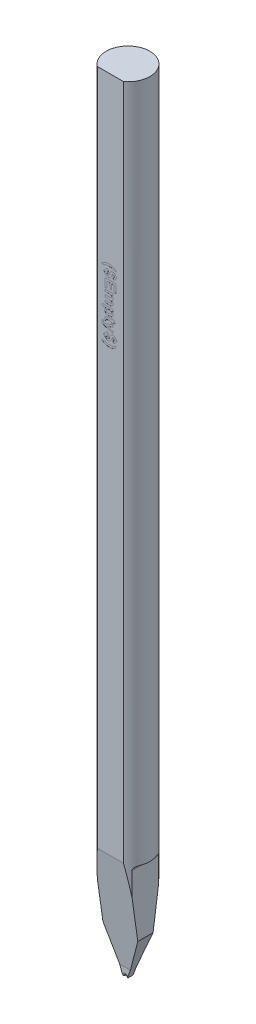
from build123d import *

# Parameters (mm, degrees)
SKETCH_TL_CUTTING_R       = 1.99771
TL_CUTTING_DEPTH          = 72.009
SKETCH_TDF_GRINDING_W     = 4.01542
SKETCH_TDF_GRINDING_H     = 4.01542
TDF_GRINDING_DEPTH        = 73.064400167
ENGRAVING_DEPTH           = 0.005
VW_VR_GRINDING_DEPTH      = 2.00771
VW_VR_GRINDING_DEPTH_BACK = 2.00771
ISA_GRINDING_DEPTH        = 2.00771
ISA_GRINDING_DEPTH_BACK   = 2.00771
PRE_FRX_BRX_DEPTH         = 2.00771
PRE_FRX_BRX_DEPTH_BACK    = 2.00771
SKETCH_PRE_FRX_BRX_W      = 1.7372
SKETCH_PRE_FRX_BRX_H      = 0.78994
FR_EDM_R                  = 0.20066
BR_EDM_R                  = 0.09906
FA_BA_GRINDING_DEPTH      = 2.00771
FA_BA_GRINDING_DEPTH_BACK = 2.00771


with BuildPart() as part:
    # sketch_TL_cutting → TL_cutting (new body)
    with BuildSketch(Plane(origin=(0, 0, 0), x_dir=(1, 0, 0), z_dir=(0, 1, 0))):
        Circle(SKETCH_TL_CUTTING_R)
    extrude(amount=TL_CUTTING_DEPTH)

    # sketch_TDF_grinding → TDF_grinding (cut, through all)
    with BuildSketch(Plane(origin=(0, 0, 0), x_dir=(1, 0, 0), z_dir=(0, 1, 0))):
        with Locations((0, -3.60918)):
            Rectangle(SKETCH_TDF_GRINDING_W, SKETCH_TDF_GRINDING_H)
    extrude(amount=TDF_GRINDING_DEPTH, mode=Mode.SUBTRACT)

    # sketch_engraving → engraving (cut)
    # profile 1 of 9: a face of its own
    with BuildSketch(Plane.XY.offset(1.60147)):
        with BuildLine():
            Line((-0.769230769, 56.611564103), (-0.769230769, 56.726948718))
            add(Edge.make_bspline(
                [(-0.769230769, 56.726948718), (-0.75654381, 56.735663826), (-0.731271202, 56.75302445), (-0.692407522, 56.777108744), (-0.653253405, 56.799807931), (-0.61390654, 56.821057444), (-0.574088198, 56.840594152), (-0.533834647, 56.85827299), (-0.493399806, 56.874882514), (-0.452559629, 56.889379278), (-0.411730957, 56.902372472), (-0.37117072, 56.913933672), (-0.330720232, 56.923167297), (-0.290776237, 56.931412038), (-0.251027852, 56.937272807), (-0.211754164, 56.941765375), (-0.172781576, 56.944468765), (-0.146905785, 56.944754889), (-0.134014423, 56.944897436)],
                knots=[0, 0, 0, 0, 1.083507766, 2.158363427, 3.217863588, 4.26952313, 5.306027247, 6.339424422, 7.364296331, 8.382863073, 9.389381803, 10.380601174, 11.351000725, 12.30983044, 13.25126181, 14.178453692, 15.092502614, 16, 16, 16, 16], degree=3))
            add(Edge.make_bspline(
                [(-0.134014423, 56.944897436), (-0.118183889, 56.944720886), (-0.086756823, 56.944370396), (-0.039956705, 56.941072127), (0.006211299, 56.935593151), (0.051774559, 56.928331702), (0.096653064, 56.918551161), (0.140935004, 56.90698945), (0.184649405, 56.893283306), (0.2131297, 56.882285182), (0.227363782, 56.876788462)],
                knots=[0, 0, 0, 0, 1.026825403, 2.038472649, 3.041589395, 4.042121555, 5.030199178, 6.019908545, 7.010375948, 8, 8, 8, 8], degree=3))
            add(Edge.make_bspline(
                [(0.227363782, 56.876788462), (0.251683724, 56.86662748), (0.300012726, 56.846435406), (0.369571494, 56.810574678), (0.43660795, 56.771337941), (0.478889333, 56.74173111), (0.5, 56.726948718)],
                knots=[0, 0, 0, 0, 1.013799707, 2.014640032, 3.00872983, 4, 4, 4, 4], degree=3))
            Line((0.5, 56.726948718), (0.5, 56.611564103))
            add(Edge.make_bspline(
                [(0.5, 56.611564103), (0.483671183, 56.618120598), (0.451734259, 56.630944202), (0.404403907, 56.648404634), (0.359131946, 56.664765299), (0.315658143, 56.679413628), (0.273946214, 56.69238068), (0.234213299, 56.70413527), (0.196217088, 56.713881677), (0.148045143, 56.725244778), (0.087918925, 56.736328711), (0.014547585, 56.745586625), (-0.060927268, 56.751701265), (-0.111967077, 56.752291015), (-0.137820513, 56.752589744)],
                knots=[0, 0, 0, 0, 0.962863393, 1.883228553, 2.76049045, 3.597092273, 4.393389301, 5.150807945, 5.864262675, 6.539665604, 7.859093728, 9.207470704, 10.585486956, 12, 12, 12, 12], degree=3))
            add(Edge.make_bspline(
                [(-0.137820513, 56.752589744), (-0.155988322, 56.752343487), (-0.192554908, 56.751847842), (-0.247746387, 56.748261408), (-0.303631191, 56.742771672), (-0.359778417, 56.734616456), (-0.415599441, 56.724983778), (-0.470281715, 56.713252997), (-0.523675907, 56.700229417), (-0.558467126, 56.689835667), (-0.575721154, 56.68468109)],
                knots=[0, 0, 0, 0, 0.980476084, 1.97341699, 2.983932057, 4.010380506, 5.034783484, 6.040583597, 7.02826557, 8, 8, 8, 8], degree=3))
            add(Edge.make_bspline(
                [(-0.575721154, 56.68468109), (-0.581680072, 56.682859776), (-0.594203733, 56.679031979), (-0.613643056, 56.671976075), (-0.635084462, 56.664505083), (-0.658352199, 56.655786341), (-0.683499135, 56.646272512), (-0.710430496, 56.635536673), (-0.739235975, 56.623981317), (-0.7590223, 56.615790194), (-0.769230769, 56.611564103)],
                knots=[0, 0, 0, 0, 0.722569934, 1.518601428, 2.397973139, 3.356076064, 4.400297102, 5.516290093, 6.718565658, 8, 8, 8, 8], degree=3))
        make_face()
    # profile 2 of 9: a face of its own
    with BuildSketch(Plane.XY.offset(1.60147)):
        with BuildLine():
            Line((-0.346153846, 56.226948718), (-0.063902244, 56.226948718))
            add(Edge.make_bspline(
                [(-0.063902244, 56.226948718), (-0.060691422, 56.237143266), (-0.054417647, 56.257062868), (-0.043102981, 56.285435864), (-0.03104034, 56.311894737), (-0.017255553, 56.335922913), (-0.002706808, 56.358195401), (0.013349437, 56.378160446), (0.030392388, 56.396185381), (0.048816212, 56.411900426), (0.068263793, 56.425644345), (0.088567069, 56.437911105), (0.110125164, 56.447723618), (0.132438861, 56.456389102), (0.155973296, 56.462652823), (0.180398952, 56.467325467), (0.205875491, 56.469883399), (0.223151848, 56.470317076), (0.231971154, 56.470538462)],
                knots=[0, 0, 0, 0, 1.233471439, 2.410137288, 3.52407584, 4.58730311, 5.604983541, 6.592165279, 7.540854934, 8.464761394, 9.382375568, 10.287963167, 11.198393515, 12.113251355, 13.048281916, 14.005296989, 14.981735836, 16, 16, 16, 16], degree=3))
            add(Edge.make_bspline(
                [(0.231971154, 56.470538462), (0.240862374, 56.470369834), (0.258371063, 56.47003777), (0.284035262, 56.466710465), (0.308630388, 56.461512705), (0.332214124, 56.454327878), (0.354666156, 56.444872426), (0.375999861, 56.433410852), (0.396225213, 56.419891645), (0.415061575, 56.404246572), (0.432812136, 56.387237259), (0.448139285, 56.36818408), (0.461933462, 56.348127842), (0.473588781, 56.326562978), (0.483166571, 56.303572929), (0.491049568, 56.279359162), (0.496663149, 56.253639945), (0.49887037, 56.235984548), (0.5, 56.226948718)],
                knots=[0, 0, 0, 0, 1.065419917, 2.098036635, 3.096580821, 4.076501369, 5.04880669, 6.012240184, 6.975806694, 7.959773282, 8.944748783, 9.917449457, 10.885494533, 11.859775015, 12.849941464, 13.867618658, 14.908671599, 16, 16, 16, 16], degree=3))
            Line((0.5, 56.226948718), (0.576923077, 56.226948718))
            Line((0.576923077, 56.226948718), (0.576923077, 56.124384615))
            Line((0.576923077, 56.124384615), (0.5, 56.124384615))
            add(Edge.make_bspline(
                [(0.5, 56.124384615), (0.498841424, 56.115486686), (0.496573389, 56.09806805), (0.49137632, 56.072741064), (0.484539762, 56.048860422), (0.476339583, 56.026349842), (0.466697028, 56.005143702), (0.455518194, 55.985361964), (0.442840864, 55.966933141), (0.428527318, 55.95018479), (0.413145824, 55.934584638), (0.39610941, 55.920827789), (0.378155721, 55.908112331), (0.358829355, 55.897061433), (0.338178987, 55.887674614), (0.316411919, 55.87941047), (0.293274546, 55.872799442), (0.27733531, 55.869600771), (0.269230769, 55.867974359)],
                knots=[0, 0, 0, 0, 1.151887312, 2.254940947, 3.31604567, 4.338626222, 5.328478017, 6.30366564, 7.252607131, 8.195603958, 9.129238937, 10.061258459, 11.003163313, 11.951756149, 12.914654824, 13.913120779, 14.938895277, 16, 16, 16, 16], degree=3))
            Line((0.269230769, 55.867974359), (0.243589744, 56.034641026))
            add(Edge.make_bspline(
                [(0.243589744, 56.034641026), (0.250446456, 56.036643558), (0.263771485, 56.040535192), (0.282535036, 56.048465441), (0.299671316, 56.057678859), (0.315110354, 56.068227628), (0.328747964, 56.080224188), (0.340615646, 56.09355588), (0.351026936, 56.108191319), (0.356312409, 56.118960751), (0.358974359, 56.124384615)],
                knots=[0, 0, 0, 0, 1.132612369, 2.201068414, 3.225051706, 4.215432487, 5.161289188, 6.099220658, 7.04270083, 8, 8, 8, 8], degree=3))
            Line((0.358974359, 56.124384615), (0.095552885, 56.124384615))
            add(Edge.make_bspline(
                [(0.095552885, 56.124384615), (0.091846888, 56.111134392), (0.084711092, 56.085621445), (0.072793936, 56.049230821), (0.059721416, 56.016296736), (0.046029912, 55.986577051), (0.031359337, 55.960199095), (0.016057305, 55.936950063), (-0.000406851, 55.917264806), (-0.017692985, 55.90057685), (-0.036309981, 55.887032312), (-0.055531671, 55.874731893), (-0.076319964, 55.864821076), (-0.098285192, 55.856514134), (-0.121510852, 55.850207549), (-0.145938277, 55.845497559), (-0.171622588, 55.842996815), (-0.189164574, 55.842557523), (-0.198116987, 55.842333333)],
                knots=[0, 0, 0, 0, 1.47567488, 2.841372022, 4.104837161, 5.274356171, 6.348422789, 7.339634063, 8.254806618, 9.095728451, 9.909336987, 10.720135121, 11.540149133, 12.374211184, 13.236039526, 14.118162803, 15.039619326, 16, 16, 16, 16], degree=3))
            add(Edge.make_bspline(
                [(-0.198116987, 55.842333333), (-0.208142, 55.842575379), (-0.227850116, 55.843051216), (-0.256821167, 55.846471811), (-0.284551423, 55.852320659), (-0.311143037, 55.860302461), (-0.336478096, 55.870703856), (-0.360449465, 55.883721867), (-0.383339011, 55.898751156), (-0.405018236, 55.915957227), (-0.425053345, 55.935437905), (-0.443316442, 55.956889482), (-0.459578741, 55.980293772), (-0.474036034, 56.005432354), (-0.486703174, 56.032431862), (-0.497491454, 56.061298177), (-0.506369109, 56.092117722), (-0.510637243, 56.113464927), (-0.512820513, 56.124384615)],
                knots=[0, 0, 0, 0, 1.03830894, 2.041205585, 3.016534218, 3.970513834, 4.913295289, 5.847846025, 6.791667113, 7.746548932, 8.710133323, 9.681653264, 10.66021374, 11.657945465, 12.682082278, 13.745789509, 14.84690868, 16, 16, 16, 16], degree=3))
            Line((-0.512820513, 56.124384615), (-0.641025641, 56.124384615))
            Line((-0.641025641, 56.124384615), (-0.641025641, 56.226948718))
            Line((-0.641025641, 56.226948718), (-0.512820513, 56.226948718))
            add(Edge.make_bspline(
                [(-0.512820513, 56.226948718), (-0.511365569, 56.235993376), (-0.508497729, 56.253821301), (-0.501708114, 56.279680106), (-0.493672179, 56.304444222), (-0.483362821, 56.327734513), (-0.471282985, 56.349710338), (-0.457442831, 56.370330001), (-0.441914521, 56.389778959), (-0.424444795, 56.407782199), (-0.405185733, 56.424467381), (-0.384010208, 56.4395823), (-0.360904849, 56.452986013), (-0.335919458, 56.464741317), (-0.309230571, 56.475320078), (-0.280464835, 56.483703551), (-0.249946988, 56.491100501), (-0.228795072, 56.494457879), (-0.217948718, 56.496179487)],
                knots=[0, 0, 0, 0, 1.014565868, 1.999810643, 2.959153021, 3.896762473, 4.817401281, 5.734733625, 6.645326844, 7.571538865, 8.510548692, 9.465314575, 10.450114695, 11.466190414, 12.522838407, 13.627737783, 14.783543095, 16, 16, 16, 16], degree=3))
            Line((-0.217948718, 56.496179487), (-0.192307692, 56.329512821))
            add(Edge.make_bspline(
                [(-0.192307692, 56.329512821), (-0.201304383, 56.327560775), (-0.218871734, 56.323749123), (-0.243936875, 56.315017324), (-0.267070938, 56.304026951), (-0.287973212, 56.290797737), (-0.306574231, 56.276291657), (-0.322506138, 56.260740348), (-0.336055086, 56.244580368), (-0.342841228, 56.232732292), (-0.346153846, 56.226948718)],
                knots=[0, 0, 0, 0, 1.156277083, 2.257799727, 3.327693098, 4.368586128, 5.360870913, 6.286760294, 7.163691387, 8, 8, 8, 8], degree=3))
        make_face()
        with BuildLine():
            add(Edge.make_bspline(
                [(0.358974359, 56.226948718), (0.356717333, 56.232992086), (0.352323078, 56.244758059), (0.342207363, 56.260507034), (0.329671684, 56.273923048), (0.314627801, 56.284702628), (0.298154817, 56.293142912), (0.280699719, 56.299552483), (0.262303768, 56.303185993), (0.249748228, 56.303641235), (0.243389423, 56.303871795)],
                knots=[0, 0, 0, 0, 1.038261919, 2.021415961, 2.996868165, 3.983674221, 4.990617688, 5.975363788, 6.97461459, 8, 8, 8, 8], degree=3))
            add(Edge.make_bspline(
                [(0.243389423, 56.303871795), (0.23756032, 56.303721402), (0.225998475, 56.303423102), (0.209074665, 56.29974233), (0.192634157, 56.29441819), (0.177010257, 56.286573685), (0.16226258, 56.276278866), (0.149112783, 56.262726829), (0.137430451, 56.24612493), (0.131236645, 56.233523802), (0.128004808, 56.226948718)],
                knots=[0, 0, 0, 0, 0.946787839, 1.877924175, 2.805567745, 3.753041052, 4.711661487, 5.718097864, 6.809336945, 8, 8, 8, 8], degree=3))
            Line((0.128004808, 56.226948718), (0.358974359, 56.226948718))
        make_face(mode=Mode.SUBTRACT)
        with BuildLine():
            add(Edge.make_bspline(
                [(-0.346153846, 56.124384615), (-0.345705345, 56.116185175), (-0.34483103, 56.100201084), (-0.337601638, 56.077493624), (-0.325657788, 56.057310262), (-0.309263795, 56.040179958), (-0.289891882, 56.026342959), (-0.268342869, 56.016345675), (-0.24520997, 56.010077578), (-0.229139944, 56.009363677), (-0.220953526, 56.009)],
                knots=[0, 0, 0, 0, 1.03495557, 2.017555319, 2.978963058, 3.976357979, 4.993109917, 5.971347703, 6.966560647, 8, 8, 8, 8], degree=3))
            add(Edge.make_bspline(
                [(-0.220953526, 56.009), (-0.213643973, 56.009272343), (-0.199375663, 56.00980396), (-0.178751062, 56.015029744), (-0.159765904, 56.023484931), (-0.142238273, 56.03538561), (-0.126537208, 56.051348938), (-0.113258624, 56.071844849), (-0.101443075, 56.096373029), (-0.09589405, 56.114671881), (-0.092948718, 56.124384615)],
                knots=[0, 0, 0, 0, 0.934982296, 1.825093612, 2.705865091, 3.586179448, 4.523819282, 5.553563867, 6.701471314, 8, 8, 8, 8], degree=3))
            Line((-0.092948718, 56.124384615), (-0.346153846, 56.124384615))
        make_face(mode=Mode.SUBTRACT)
    # profile 3 of 9: a face of its own
    with BuildSketch(Plane.XY.offset(1.60147)):
        Polygon((-0.5, 55.675666667), (0.5, 55.675666667), (0.5, 54.932076923), (0.333333333, 54.932076923), (0.333333333, 55.483358974), (0.115384615, 55.483358974), (0.115384615, 54.970538462), (-0.051282051, 54.970538462), (-0.051282051, 55.483358974), (-0.333333333, 55.483358974), (-0.333333333, 54.91925641), (-0.5, 54.91925641), align=None)
    # profile 4 of 9: a face of its own
    with BuildSketch(Plane.XY.offset(1.60147)):
        with BuildLine():
            Line((0.230769231, 54.778230769), (0.230769231, 54.585923077))
            Line((0.230769231, 54.585923077), (0.1328125, 54.585923077))
            add(Edge.make_bspline(
                [(0.1328125, 54.585923077), (0.141664699, 54.578359049), (0.158931351, 54.563605038), (0.181382685, 54.538923789), (0.200586186, 54.513416739), (0.21644089, 54.486832809), (0.228531159, 54.458934117), (0.237134296, 54.429946875), (0.242539521, 54.399891949), (0.243237377, 54.379481895), (0.243589744, 54.369176282)],
                knots=[0, 0, 0, 0, 1.107940857, 2.161093632, 3.169644562, 4.144639019, 5.101548547, 6.057210626, 7.019030711, 8, 8, 8, 8], degree=3))
            add(Edge.make_bspline(
                [(0.243589744, 54.369176282), (0.243215794, 54.358410033), (0.242486901, 54.337424744), (0.237632212, 54.306967189), (0.228624904, 54.278890488), (0.216596826, 54.25293503), (0.200997643, 54.229186923), (0.181697421, 54.207803483), (0.1589088, 54.188570942), (0.141647297, 54.178047815), (0.1328125, 54.172661859)],
                knots=[0, 0, 0, 0, 1.087442074, 2.119613481, 3.102840357, 4.056171906, 5.000733146, 5.960649063, 6.95621775, 8, 8, 8, 8], degree=3))
            add(Edge.make_bspline(
                [(0.1328125, 54.172661859), (0.141648331, 54.164741809), (0.15890459, 54.149274061), (0.18160607, 54.123912536), (0.200837622, 54.097588586), (0.216342266, 54.070185607), (0.228440547, 54.041886572), (0.237463475, 54.012736515), (0.242455792, 53.982395313), (0.243209151, 53.961874823), (0.243589744, 53.951508013)],
                knots=[0, 0, 0, 0, 1.113355786, 2.174368662, 3.188819075, 4.168565139, 5.12342631, 6.073356391, 7.026672896, 8, 8, 8, 8], degree=3))
            add(Edge.make_bspline(
                [(0.243589744, 53.951508013), (0.243253707, 53.938725949), (0.242603687, 53.914000698), (0.236233833, 53.878451934), (0.226092646, 53.845846208), (0.211825029, 53.816371427), (0.193628332, 53.79007465), (0.171312748, 53.767536921), (0.145297956, 53.748199279), (0.125650654, 53.738783721), (0.115584936, 53.733959936)],
                knots=[0, 0, 0, 0, 1.140905914, 2.206935121, 3.214358517, 4.182792527, 5.121068659, 6.057503675, 7.004819049, 8, 8, 8, 8], degree=3))
            add(Edge.make_bspline(
                [(0.115584936, 53.733959936), (0.1114006, 53.732358143), (0.102614163, 53.728994633), (0.088193677, 53.7250406), (0.07205936, 53.721717836), (0.05407705, 53.718900231), (0.034354022, 53.716783997), (0.012779717, 53.715109993), (-0.010546601, 53.714459858), (-0.026709385, 53.714241149), (-0.03505609, 53.714128205)],
                knots=[0, 0, 0, 0, 0.70348757, 1.477211565, 2.345356006, 3.290383569, 4.335215205, 5.460703428, 6.68866909, 8, 8, 8, 8], degree=3))
            Line((-0.03505609, 53.714128205), (-0.5, 53.714128205))
            Line((-0.5, 53.714128205), (-0.5, 53.906435897))
            Line((-0.5, 53.906435897), (-0.080128205, 53.906435897))
            add(Edge.make_bspline(
                [(-0.080128205, 53.906435897), (-0.07144761, 53.906547935), (-0.054817384, 53.906762576), (-0.031090468, 53.907406731), (-0.009777274, 53.909044643), (0.009076857, 53.911186366), (0.025551617, 53.91391905), (0.039613136, 53.917295096), (0.051411557, 53.921089266), (0.058064109, 53.924645803), (0.061097756, 53.926267628)],
                knots=[0, 0, 0, 0, 1.448583407, 2.775186282, 3.959557885, 5.014017743, 5.940851432, 6.743435621, 7.42699079, 8, 8, 8, 8], degree=3))
            add(Edge.make_bspline(
                [(0.061097756, 53.926267628), (0.0644449, 53.928508242), (0.071015994, 53.932907002), (0.079428524, 53.94104351), (0.086594396, 53.949987573), (0.092366124, 53.959872082), (0.097066603, 53.970530677), (0.100204228, 53.982148841), (0.10230955, 53.994633517), (0.102477414, 54.003314837), (0.102564103, 54.007798077)],
                knots=[0, 0, 0, 0, 1.007330723, 1.977586358, 2.91811154, 3.870610884, 4.837109745, 5.827490497, 6.87806446, 8, 8, 8, 8], degree=3))
            add(Edge.make_bspline(
                [(0.102564103, 54.007798077), (0.102240034, 54.01443365), (0.101593875, 54.027664313), (0.09685111, 54.047122239), (0.088810593, 54.065848966), (0.077873982, 54.083699946), (0.064089543, 54.100338814), (0.046951113, 54.114414723), (0.027058253, 54.126184107), (0.008201325, 54.133566057), (-0.008714124, 54.138275058), (-0.023370098, 54.141428886), (-0.039736185, 54.144230026), (-0.057919723, 54.146426211), (-0.07777632, 54.14791842), (-0.09941442, 54.149127695), (-0.122723067, 54.149973668), (-0.138888099, 54.150007942), (-0.147235577, 54.150025641)],
                knots=[0, 0, 0, 0, 0.980909897, 1.955835539, 2.942693402, 3.98436442, 5.042755257, 6.12263035, 7.247279534, 8.448501813, 9.105087946, 9.843148781, 10.66469806, 11.560151265, 12.550905382, 13.609296218, 14.765461946, 16, 16, 16, 16], degree=3))
            Line((-0.147235577, 54.150025641), (-0.5, 54.150025641))
            Line((-0.5, 54.150025641), (-0.5, 54.342333333))
            Line((-0.5, 54.342333333), (-0.097355769, 54.342333333))
            add(Edge.make_bspline(
                [(-0.097355769, 54.342333333), (-0.088808683, 54.342387673), (-0.072514885, 54.342491264), (-0.049272866, 54.342832415), (-0.028431625, 54.343598963), (-0.010001412, 54.344816338), (0.006094573, 54.346219335), (0.019817647, 54.347693711), (0.031211059, 54.3496468), (0.042972639, 54.352762901), (0.055281064, 54.357674574), (0.068015353, 54.364905367), (0.078952496, 54.37337508), (0.087734398, 54.383592499), (0.094431133, 54.39552783), (0.099289836, 54.409190268), (0.101996826, 54.424759663), (0.102369061, 54.435739069), (0.102564103, 54.441491987)],
                knots=[0, 0, 0, 0, 1.59941463, 3.049055322, 4.349500855, 5.501487129, 6.504910079, 7.372843676, 8.083634967, 8.665560774, 9.647038445, 10.55368294, 11.398647399, 12.222657519, 13.056461931, 13.945719492, 14.92361148, 16, 16, 16, 16], degree=3))
            add(Edge.make_bspline(
                [(0.102564103, 54.441491987), (0.102234348, 54.448658367), (0.101586917, 54.462728621), (0.097099356, 54.483322194), (0.089385598, 54.502697199), (0.078745529, 54.520760574), (0.065308531, 54.537164364), (0.048811546, 54.551063128), (0.02977557, 54.562600394), (0.011740073, 54.569890429), (-0.004479026, 54.57462018), (-0.018770373, 54.57751101), (-0.034874654, 54.580111233), (-0.052844538, 54.58232052), (-0.072766981, 54.583839446), (-0.094540599, 54.585014918), (-0.118182385, 54.585875318), (-0.134547779, 54.585906775), (-0.143028846, 54.585923077)],
                knots=[0, 0, 0, 0, 1.061105177, 2.08334182, 3.104381884, 4.137278018, 5.176827868, 6.229094397, 7.316239487, 8.460364206, 9.09881589, 9.816452537, 10.617971519, 11.514628853, 12.496857794, 13.576419947, 14.74402393, 16, 16, 16, 16], degree=3))
            Line((-0.143028846, 54.585923077), (-0.5, 54.585923077))
            Line((-0.5, 54.585923077), (-0.5, 54.778230769))
            Line((-0.5, 54.778230769), (0.230769231, 54.778230769))
        make_face()
    # profile 5 of 9: a face of its own
    with BuildSketch(Plane.XY.offset(1.60147)):
        with BuildLine():
            Line((0.230769231, 53.521820513), (0.230769231, 53.329512821))
            Line((0.230769231, 53.329512821), (0.125400641, 53.329512821))
            add(Edge.make_bspline(
                [(0.125400641, 53.329512821), (0.134110558, 53.323789731), (0.151482958, 53.312374718), (0.174623276, 53.291319889), (0.194727471, 53.267179744), (0.21216262, 53.240640955), (0.226252501, 53.211806915), (0.236247247, 53.181133514), (0.242498657, 53.148943396), (0.243222023, 53.126950728), (0.243589744, 53.115770833)],
                knots=[0, 0, 0, 0, 0.978547196, 1.95176541, 2.927409496, 3.924956672, 4.929940552, 5.934297003, 6.949907262, 8, 8, 8, 8], degree=3))
            add(Edge.make_bspline(
                [(0.243589744, 53.115770833), (0.243275199, 53.106003359), (0.242653327, 53.086692556), (0.237904657, 53.058336182), (0.230300531, 53.031019066), (0.219424348, 53.00483804), (0.205256392, 52.979900966), (0.188112758, 52.956138662), (0.167850875, 52.933577666), (0.144791975, 52.912281795), (0.118886648, 52.892784547), (0.090438984, 52.875746955), (0.059420431, 52.861512172), (0.02614289, 52.849614093), (-0.00973483, 52.840790018), (-0.047865347, 52.834089032), (-0.088468702, 52.830383122), (-0.116312431, 52.82980808), (-0.130608974, 52.829512821)],
                knots=[0, 0, 0, 0, 0.889183518, 1.757962001, 2.610823862, 3.466866804, 4.332788647, 5.217155532, 6.130223362, 7.089913047, 8.071415563, 9.077827182, 10.103546864, 11.174887114, 12.291391641, 13.464112916, 14.69793237, 16, 16, 16, 16], degree=3))
            add(Edge.make_bspline(
                [(-0.130608974, 52.829512821), (-0.145309675, 52.829777446), (-0.173899782, 52.830292094), (-0.215458383, 52.834402127), (-0.254585771, 52.840776506), (-0.291083626, 52.85058219), (-0.325347568, 52.862394954), (-0.356921697, 52.877327394), (-0.386073852, 52.894801106), (-0.412336985, 52.915059239), (-0.435948519, 52.936992733), (-0.456547424, 52.960307103), (-0.473866574, 52.984832979), (-0.488041441, 53.010500814), (-0.499108447, 53.03731691), (-0.507216556, 53.065229904), (-0.511869709, 53.094380749), (-0.512500462, 53.114152095), (-0.512820513, 53.124184295)],
                knots=[0, 0, 0, 0, 1.306276956, 2.54046374, 3.708317787, 4.825351227, 5.895229917, 6.925275359, 7.923721025, 8.910100439, 9.867470588, 10.784172372, 11.670002506, 12.530604141, 13.384735846, 14.243124713, 15.108541968, 16, 16, 16, 16], degree=3))
            add(Edge.make_bspline(
                [(-0.512820513, 53.124184295), (-0.512609167, 53.133690186), (-0.512194245, 53.152352468), (-0.507198627, 53.179557904), (-0.500287281, 53.205588151), (-0.489449809, 53.230441328), (-0.475076841, 53.254817244), (-0.456848814, 53.279593251), (-0.434276455, 53.304830916), (-0.417064851, 53.321030662), (-0.408052885, 53.329512821)],
                knots=[0, 0, 0, 0, 0.955822701, 1.876503125, 2.776905967, 3.662325514, 4.596312032, 5.620965962, 6.754341905, 8, 8, 8, 8], degree=3))
            Line((-0.408052885, 53.329512821), (-0.769230769, 53.329512821))
            Line((-0.769230769, 53.329512821), (-0.769230769, 53.521820513))
            Line((-0.769230769, 53.521820513), (0.230769231, 53.521820513))
        make_face()
        with BuildLine():
            add(Edge.make_bspline(
                [(-0.122195513, 53.329512821), (-0.132481435, 53.329330938), (-0.152405274, 53.328978631), (-0.181244648, 53.327077339), (-0.208037309, 53.323546885), (-0.232684253, 53.318235747), (-0.255441334, 53.312050174), (-0.275988928, 53.303930804), (-0.294539024, 53.294622167), (-0.310824186, 53.283698167), (-0.325130191, 53.271818833), (-0.337524496, 53.259247515), (-0.348144327, 53.246075436), (-0.356821345, 53.23224956), (-0.363446941, 53.217669312), (-0.368372821, 53.202507368), (-0.371163803, 53.186653237), (-0.371583715, 53.175877184), (-0.371794872, 53.170458333)],
                knots=[0, 0, 0, 0, 1.493314022, 2.892550594, 4.193549699, 5.412205958, 6.550654332, 7.612709232, 8.614154521, 9.557822924, 10.452682187, 11.309508678, 12.116407821, 12.904513946, 13.672267114, 14.435601522, 15.213325928, 16, 16, 16, 16], degree=3))
            add(Edge.make_bspline(
                [(-0.371794872, 53.170458333), (-0.371659076, 53.165238996), (-0.371390934, 53.154932918), (-0.368717534, 53.139850329), (-0.36428733, 53.1254401), (-0.35796517, 53.111782234), (-0.350180339, 53.098647389), (-0.340400371, 53.086335676), (-0.328879204, 53.074787269), (-0.315890023, 53.063521873), (-0.300495775, 53.053808804), (-0.283066961, 53.045116707), (-0.26342759, 53.037702345), (-0.241425455, 53.032059812), (-0.21727146, 53.027453704), (-0.190916328, 53.02410908), (-0.162291664, 53.022084026), (-0.142498204, 53.021910628), (-0.132211538, 53.021820513)],
                knots=[0, 0, 0, 0, 0.791436533, 1.562766886, 2.315979036, 3.073269983, 3.841398674, 4.627954771, 5.451998839, 6.314818792, 7.231140921, 8.205467689, 9.266952699, 10.409907015, 11.648037837, 12.996681567, 14.439174734, 16, 16, 16, 16], degree=3))
            add(Edge.make_bspline(
                [(-0.132211538, 53.021820513), (-0.122590159, 53.021885744), (-0.103987384, 53.022011868), (-0.077055352, 53.024396462), (-0.051997139, 53.027603604), (-0.028873936, 53.032518131), (-0.007518455, 53.038306551), (0.01172948, 53.046020618), (0.029199081, 53.054792491), (0.044606747, 53.065096056), (0.058319539, 53.076225976), (0.069887203, 53.088411635), (0.080128065, 53.10083484), (0.08840061, 53.11408001), (0.094621072, 53.128151434), (0.099305551, 53.142696751), (0.101912651, 53.158013515), (0.102344136, 53.168379172), (0.102564103, 53.173663462)],
                knots=[0, 0, 0, 0, 1.476459806, 2.854710082, 4.147877, 5.352136794, 6.481419541, 7.539804139, 8.530071065, 9.476830027, 10.379846701, 11.23529603, 12.051777807, 12.848258948, 13.623682229, 14.408266492, 15.188553102, 16, 16, 16, 16], degree=3))
            add(Edge.make_bspline(
                [(0.102564103, 53.173663462), (0.102455308, 53.179153683), (0.102241498, 53.189943463), (0.099201363, 53.205705699), (0.094853437, 53.220854844), (0.088686029, 53.235317083), (0.080452533, 53.248825762), (0.070807323, 53.261847745), (0.059117992, 53.273947129), (0.045859614, 53.285459774), (0.030812699, 53.295916203), (0.01390315, 53.304896172), (-0.00466452, 53.312440447), (-0.024767533, 53.318971117), (-0.046730612, 53.323669687), (-0.070369893, 53.326944967), (-0.095705859, 53.329315572), (-0.113175154, 53.329445653), (-0.122195513, 53.329512821)],
                knots=[0, 0, 0, 0, 0.85812159, 1.686442648, 2.503408574, 3.322778131, 4.138405645, 4.97460315, 5.854412976, 6.765937777, 7.719865152, 8.715925653, 9.756353289, 10.85381274, 12.020422519, 13.266547949, 14.588568337, 16, 16, 16, 16], degree=3))
        make_face(mode=Mode.SUBTRACT)
    # profile 6 of 9: a face of its own
    with BuildSketch(Plane.XY.offset(1.60147)):
        with BuildLine():
            Line((0.230769231, 52.329512821), (0.08974359, 52.329512821))
            Line((0.08974359, 52.329512821), (0.08974359, 52.470538462))
            Line((0.08974359, 52.470538462), (-0.224358974, 52.470538462))
            add(Edge.make_bspline(
                [(-0.224358974, 52.470538462), (-0.231904339, 52.47055171), (-0.246127351, 52.470576684), (-0.266228543, 52.470412391), (-0.283853768, 52.469932133), (-0.299018236, 52.469649783), (-0.311701045, 52.46897022), (-0.321861303, 52.468462927), (-0.329566697, 52.467740323), (-0.338907815, 52.466012609), (-0.35057578, 52.46098511), (-0.360389431, 52.451317637), (-0.366182432, 52.44179528), (-0.369474906, 52.433766405), (-0.371514578, 52.424967167), (-0.371700117, 52.418800144), (-0.371794872, 52.415650641)],
                knots=[0, 0, 0, 0, 1.773599637, 3.343235314, 4.724802322, 5.918078765, 6.908020279, 7.709878159, 8.309605123, 8.725167438, 9.94114383, 11.228754835, 11.890951744, 12.552590386, 13.260806876, 14, 14, 14, 14], degree=3))
            add(Edge.make_bspline(
                [(-0.371794872, 52.415650641), (-0.371507964, 52.410495649), (-0.37087716, 52.399161728), (-0.367095421, 52.380687003), (-0.361305779, 52.35922894), (-0.356131124, 52.344040802), (-0.353365385, 52.335923077)],
                knots=[0, 0, 0, 0, 0.75345353, 1.656565626, 2.747486109, 4, 4, 4, 4], degree=3))
            Line((-0.353365385, 52.335923077), (-0.487379808, 52.316692308))
            add(Edge.make_bspline(
                [(-0.487379808, 52.316692308), (-0.491390152, 52.328369641), (-0.499569528, 52.352186373), (-0.506906498, 52.3900411), (-0.512003384, 52.42993354), (-0.512543433, 52.457299316), (-0.512820513, 52.471339744)],
                knots=[0, 0, 0, 0, 0.939563481, 1.916305015, 2.930928536, 4, 4, 4, 4], degree=3))
            add(Edge.make_bspline(
                [(-0.512820513, 52.471339744), (-0.512564303, 52.479962381), (-0.512063975, 52.49680071), (-0.50889268, 52.521457549), (-0.50326966, 52.544746429), (-0.495519476, 52.566499989), (-0.485995694, 52.586145599), (-0.475305475, 52.603448436), (-0.462868601, 52.617641671), (-0.449141562, 52.629497462), (-0.433202705, 52.638848766), (-0.415065056, 52.646272715), (-0.394648734, 52.652652966), (-0.380046946, 52.655266675), (-0.372395833, 52.656636218)],
                knots=[0, 0, 0, 0, 1.203015215, 2.349253984, 3.460901624, 4.539344044, 5.564274864, 6.502382232, 7.367332183, 8.186789841, 9.022345106, 9.932420497, 10.916620053, 12, 12, 12, 12], degree=3))
            add(Edge.make_bspline(
                [(-0.372395833, 52.656636218), (-0.369192653, 52.657116428), (-0.362066116, 52.658184813), (-0.35025766, 52.659634383), (-0.336212257, 52.660528825), (-0.319980191, 52.661261789), (-0.301558032, 52.662201997), (-0.280981809, 52.662400781), (-0.258215711, 52.66297611), (-0.242321525, 52.662890903), (-0.233974359, 52.662846154)],
                knots=[0, 0, 0, 0, 0.560521704, 1.24706641, 2.057998689, 2.995119087, 4.059211621, 5.249632546, 6.555586685, 8, 8, 8, 8], degree=3))
            Line((-0.233974359, 52.662846154), (0.08974359, 52.662846154))
            Line((0.08974359, 52.662846154), (0.08974359, 52.752589744))
            Line((0.08974359, 52.752589744), (0.230769231, 52.752589744))
            Line((0.230769231, 52.752589744), (0.230769231, 52.662846154))
            Line((0.230769231, 52.662846154), (0.371794872, 52.662846154))
            Line((0.371794872, 52.662846154), (0.487179487, 52.470538462))
            Line((0.487179487, 52.470538462), (0.230769231, 52.470538462))
            Line((0.230769231, 52.470538462), (0.230769231, 52.329512821))
        make_face()
    # profile 7 of 9: a face of its own
    with BuildSketch(Plane.XY.offset(1.60147)):
        with BuildLine():
            Line((0.230769231, 52.303871795), (0.230769231, 52.111564103))
            Line((0.230769231, 52.111564103), (-0.286658654, 51.951307692))
            Line((-0.286658654, 51.951307692), (0.230769231, 51.791051282))
            Line((0.230769231, 51.791051282), (0.230769231, 51.59874359))
            Line((0.230769231, 51.59874359), (-0.466145833, 51.841732372))
            Line((-0.466145833, 51.841732372), (-0.598157051, 51.88780609))
            add(Edge.make_bspline(
                [(-0.598157051, 51.88780609), (-0.607606652, 51.89159762), (-0.625376306, 51.898727464), (-0.650028536, 51.910049297), (-0.671175741, 51.920862611), (-0.689167457, 51.931709184), (-0.704516652, 51.942913706), (-0.717943024, 51.954827994), (-0.730162212, 51.967284886), (-0.740813451, 51.980793571), (-0.750254429, 51.995532496), (-0.758328481, 52.011776596), (-0.76563939, 52.029473804), (-0.771559687, 52.048799905), (-0.776455479, 52.06952306), (-0.779384556, 52.091675696), (-0.781869716, 52.114981275), (-0.781989673, 52.130987518), (-0.782051282, 52.139208333)],
                knots=[0, 0, 0, 0, 1.442318569, 2.712231111, 3.841952651, 4.805677934, 5.685519496, 6.530069912, 7.346275571, 8.154437428, 8.962710014, 9.821550927, 10.7210084, 11.672490954, 12.682200373, 13.733763549, 14.836059795, 16, 16, 16, 16], degree=3))
            add(Edge.make_bspline(
                [(-0.782051282, 52.139208333), (-0.7816451, 52.156217724), (-0.780837731, 52.190027353), (-0.77455582, 52.223257127), (-0.771434295, 52.239769231)],
                knots=[0, 0, 0, 0, 1.006186215, 2, 2, 2, 2], degree=3))
            Line((-0.771434295, 52.239769231), (-0.632011218, 52.252589744))
            add(Edge.make_bspline(
                [(-0.632011218, 52.252589744), (-0.633415338, 52.245992157), (-0.636126927, 52.233251116), (-0.638960851, 52.214460996), (-0.640597369, 52.196662949), (-0.640885825, 52.185084749), (-0.641025641, 52.179472756)],
                knots=[0, 0, 0, 0, 1.096454798, 2.117437249, 3.087515614, 4, 4, 4, 4], degree=3))
            add(Edge.make_bspline(
                [(-0.641025641, 52.179472756), (-0.64091732, 52.174592773), (-0.640708773, 52.165197485), (-0.638908081, 52.151550373), (-0.635715822, 52.138918389), (-0.631252096, 52.127272811), (-0.625903073, 52.116443406), (-0.618924188, 52.106731769), (-0.610797334, 52.097950602), (-0.597999124, 52.087623602), (-0.579899103, 52.076234316), (-0.555710912, 52.064504301), (-0.528917644, 52.054174693), (-0.509869412, 52.048960982), (-0.5, 52.046259615)],
                knots=[0, 0, 0, 0, 0.826282398, 1.5908173, 2.325927711, 3.027474672, 3.700169566, 4.365407898, 5.04557163, 5.720354759, 7.144619778, 8.656909909, 10.267853154, 12, 12, 12, 12], degree=3))
            Line((-0.5, 52.046259615), (0.230769231, 52.303871795))
        make_face()
    # profile 8 of 9: a face of its own
    with BuildSketch(Plane.XY.offset(1.60147)):
        with BuildLine():
            Line((-0.346153846, 51.226948718), (-0.063902244, 51.226948718))
            add(Edge.make_bspline(
                [(-0.063902244, 51.226948718), (-0.060691422, 51.237143266), (-0.054417647, 51.257062868), (-0.043102981, 51.285435864), (-0.03104034, 51.311894737), (-0.017255553, 51.335922913), (-0.002706808, 51.358195401), (0.013349437, 51.378160446), (0.030392388, 51.396185381), (0.048816212, 51.411900426), (0.068263793, 51.425644345), (0.088567069, 51.437911105), (0.110125164, 51.447723618), (0.132438861, 51.456389102), (0.155973296, 51.462652823), (0.180398952, 51.467325467), (0.205875491, 51.469883399), (0.223151848, 51.470317076), (0.231971154, 51.470538462)],
                knots=[0, 0, 0, 0, 1.233471439, 2.410137288, 3.52407584, 4.58730311, 5.604983541, 6.592165279, 7.540854934, 8.464761394, 9.382375568, 10.287963167, 11.198393515, 12.113251355, 13.048281916, 14.005296989, 14.981735836, 16, 16, 16, 16], degree=3))
            add(Edge.make_bspline(
                [(0.231971154, 51.470538462), (0.240862374, 51.470369834), (0.258371063, 51.47003777), (0.284035262, 51.466710465), (0.308630388, 51.461512705), (0.332214124, 51.454327878), (0.354666156, 51.444872426), (0.375999861, 51.433410852), (0.396225213, 51.419891645), (0.415061575, 51.404246572), (0.432812136, 51.387237259), (0.448139285, 51.36818408), (0.461933462, 51.348127842), (0.473588781, 51.326562978), (0.483166571, 51.303572929), (0.491049568, 51.279359162), (0.496663149, 51.253639945), (0.49887037, 51.235984548), (0.5, 51.226948718)],
                knots=[0, 0, 0, 0, 1.065419917, 2.098036635, 3.096580821, 4.076501369, 5.04880669, 6.012240184, 6.975806694, 7.959773282, 8.944748783, 9.917449457, 10.885494533, 11.859775015, 12.849941464, 13.867618658, 14.908671599, 16, 16, 16, 16], degree=3))
            Line((0.5, 51.226948718), (0.576923077, 51.226948718))
            Line((0.576923077, 51.226948718), (0.576923077, 51.124384615))
            Line((0.576923077, 51.124384615), (0.5, 51.124384615))
            add(Edge.make_bspline(
                [(0.5, 51.124384615), (0.498841424, 51.115486686), (0.496573389, 51.09806805), (0.49137632, 51.072741064), (0.484539762, 51.048860422), (0.476339583, 51.026349842), (0.466697028, 51.005143702), (0.455518194, 50.985361964), (0.442840864, 50.966933141), (0.428527318, 50.95018479), (0.413145824, 50.934584638), (0.39610941, 50.920827789), (0.378155721, 50.908112331), (0.358829355, 50.897061433), (0.338178987, 50.887674614), (0.316411919, 50.87941047), (0.293274546, 50.872799442), (0.27733531, 50.869600771), (0.269230769, 50.867974359)],
                knots=[0, 0, 0, 0, 1.151887312, 2.254940947, 3.31604567, 4.338626222, 5.328478017, 6.30366564, 7.252607131, 8.195603958, 9.129238937, 10.061258459, 11.003163313, 11.951756149, 12.914654824, 13.913120779, 14.938895277, 16, 16, 16, 16], degree=3))
            Line((0.269230769, 50.867974359), (0.243589744, 51.034641026))
            add(Edge.make_bspline(
                [(0.243589744, 51.034641026), (0.250446456, 51.036643558), (0.263771485, 51.040535192), (0.282535036, 51.048465441), (0.299671316, 51.057678859), (0.315110354, 51.068227628), (0.328747964, 51.080224188), (0.340615646, 51.09355588), (0.351026936, 51.108191319), (0.356312409, 51.118960751), (0.358974359, 51.124384615)],
                knots=[0, 0, 0, 0, 1.132612369, 2.201068414, 3.225051706, 4.215432487, 5.161289188, 6.099220658, 7.04270083, 8, 8, 8, 8], degree=3))
            Line((0.358974359, 51.124384615), (0.095552885, 51.124384615))
            add(Edge.make_bspline(
                [(0.095552885, 51.124384615), (0.091846888, 51.111134392), (0.084711092, 51.085621445), (0.072793936, 51.049230821), (0.059721416, 51.016296736), (0.046029912, 50.986577051), (0.031359337, 50.960199095), (0.016057305, 50.936950063), (-0.000406851, 50.917264806), (-0.017692985, 50.90057685), (-0.036309981, 50.887032312), (-0.055531671, 50.874731893), (-0.076319964, 50.864821076), (-0.098285192, 50.856514134), (-0.121510852, 50.850207549), (-0.145938277, 50.845497559), (-0.171622588, 50.842996815), (-0.189164574, 50.842557523), (-0.198116987, 50.842333333)],
                knots=[0, 0, 0, 0, 1.47567488, 2.841372022, 4.104837161, 5.274356171, 6.348422789, 7.339634063, 8.254806618, 9.095728451, 9.909336987, 10.720135121, 11.540149133, 12.374211184, 13.236039526, 14.118162803, 15.039619326, 16, 16, 16, 16], degree=3))
            add(Edge.make_bspline(
                [(-0.198116987, 50.842333333), (-0.208142, 50.842575379), (-0.227850116, 50.843051216), (-0.256821167, 50.846471811), (-0.284551423, 50.852320659), (-0.311143037, 50.860302461), (-0.336478096, 50.870703856), (-0.360449465, 50.883721867), (-0.383339011, 50.898751156), (-0.405018236, 50.915957227), (-0.425053345, 50.935437905), (-0.443316442, 50.956889482), (-0.459578741, 50.980293772), (-0.474036034, 51.005432354), (-0.486703174, 51.032431862), (-0.497491454, 51.061298177), (-0.506369109, 51.092117722), (-0.510637243, 51.113464927), (-0.512820513, 51.124384615)],
                knots=[0, 0, 0, 0, 1.03830894, 2.041205585, 3.016534218, 3.970513834, 4.913295289, 5.847846025, 6.791667113, 7.746548932, 8.710133323, 9.681653264, 10.66021374, 11.657945465, 12.682082278, 13.745789509, 14.84690868, 16, 16, 16, 16], degree=3))
            Line((-0.512820513, 51.124384615), (-0.641025641, 51.124384615))
            Line((-0.641025641, 51.124384615), (-0.641025641, 51.226948718))
            Line((-0.641025641, 51.226948718), (-0.512820513, 51.226948718))
            add(Edge.make_bspline(
                [(-0.512820513, 51.226948718), (-0.511365569, 51.235993376), (-0.508497729, 51.253821301), (-0.501708114, 51.279680106), (-0.493672179, 51.304444222), (-0.483362821, 51.327734513), (-0.471282985, 51.349710338), (-0.457442831, 51.370330001), (-0.441914521, 51.389778959), (-0.424444795, 51.407782199), (-0.405185733, 51.424467381), (-0.384010208, 51.4395823), (-0.360904849, 51.452986013), (-0.335919458, 51.464741317), (-0.309230571, 51.475320078), (-0.280464835, 51.483703551), (-0.249946988, 51.491100501), (-0.228795072, 51.494457879), (-0.217948718, 51.496179487)],
                knots=[0, 0, 0, 0, 1.014565868, 1.999810643, 2.959153021, 3.896762473, 4.817401281, 5.734733625, 6.645326844, 7.571538865, 8.510548692, 9.465314575, 10.450114695, 11.466190414, 12.522838407, 13.627737783, 14.783543095, 16, 16, 16, 16], degree=3))
            Line((-0.217948718, 51.496179487), (-0.192307692, 51.329512821))
            add(Edge.make_bspline(
                [(-0.192307692, 51.329512821), (-0.201304383, 51.327560775), (-0.218871734, 51.323749123), (-0.243936875, 51.315017324), (-0.267070938, 51.304026951), (-0.287973212, 51.290797737), (-0.306574231, 51.276291657), (-0.322506138, 51.260740348), (-0.336055086, 51.244580368), (-0.342841228, 51.232732292), (-0.346153846, 51.226948718)],
                knots=[0, 0, 0, 0, 1.156277083, 2.257799727, 3.327693098, 4.368586128, 5.360870913, 6.286760294, 7.163691387, 8, 8, 8, 8], degree=3))
        make_face()
        with BuildLine():
            add(Edge.make_bspline(
                [(0.358974359, 51.226948718), (0.356717333, 51.232992086), (0.352323078, 51.244758059), (0.342207363, 51.260507034), (0.329671684, 51.273923048), (0.314627801, 51.284702628), (0.298154817, 51.293142912), (0.280699719, 51.299552483), (0.262303768, 51.303185993), (0.249748228, 51.303641235), (0.243389423, 51.303871795)],
                knots=[0, 0, 0, 0, 1.038261919, 2.021415961, 2.996868165, 3.983674221, 4.990617688, 5.975363788, 6.97461459, 8, 8, 8, 8], degree=3))
            add(Edge.make_bspline(
                [(0.243389423, 51.303871795), (0.23756032, 51.303721402), (0.225998475, 51.303423102), (0.209074665, 51.29974233), (0.192634157, 51.29441819), (0.177010257, 51.286573685), (0.16226258, 51.276278866), (0.149112783, 51.262726829), (0.137430451, 51.24612493), (0.131236645, 51.233523802), (0.128004808, 51.226948718)],
                knots=[0, 0, 0, 0, 0.946787839, 1.877924175, 2.805567745, 3.753041052, 4.711661487, 5.718097864, 6.809336945, 8, 8, 8, 8], degree=3))
            Line((0.128004808, 51.226948718), (0.358974359, 51.226948718))
        make_face(mode=Mode.SUBTRACT)
        with BuildLine():
            add(Edge.make_bspline(
                [(-0.346153846, 51.124384615), (-0.345705345, 51.116185175), (-0.34483103, 51.100201084), (-0.337601638, 51.077493624), (-0.325657788, 51.057310262), (-0.309263795, 51.040179958), (-0.289891882, 51.026342959), (-0.268342869, 51.016345675), (-0.24520997, 51.010077578), (-0.229139944, 51.009363677), (-0.220953526, 51.009)],
                knots=[0, 0, 0, 0, 1.03495557, 2.017555319, 2.978963058, 3.976357979, 4.993109917, 5.971347703, 6.966560647, 8, 8, 8, 8], degree=3))
            add(Edge.make_bspline(
                [(-0.220953526, 51.009), (-0.213643973, 51.009272343), (-0.199375663, 51.00980396), (-0.178751062, 51.015029744), (-0.159765904, 51.023484931), (-0.142238273, 51.03538561), (-0.126537208, 51.051348938), (-0.113258624, 51.071844849), (-0.101443075, 51.096373029), (-0.09589405, 51.114671881), (-0.092948718, 51.124384615)],
                knots=[0, 0, 0, 0, 0.934982296, 1.825093612, 2.705865091, 3.586179448, 4.523819282, 5.553563867, 6.701471314, 8, 8, 8, 8], degree=3))
            Line((-0.092948718, 51.124384615), (-0.346153846, 51.124384615))
        make_face(mode=Mode.SUBTRACT)
    # profile 9 of 9: a face of its own
    with BuildSketch(Plane.XY.offset(1.60147)):
        with BuildLine():
            add(Edge.make_bspline(
                [(-0.769230769, 50.714128205), (-0.759753751, 50.710176748), (-0.741349534, 50.702503082), (-0.714488413, 50.691530989), (-0.689411686, 50.681199446), (-0.66582053, 50.672377563), (-0.644337438, 50.663765597), (-0.624360182, 50.656623504), (-0.606142026, 50.650180581), (-0.583717551, 50.642584923), (-0.555722553, 50.634016591), (-0.520665287, 50.624665662), (-0.48334227, 50.61546875), (-0.444143274, 50.606747739), (-0.404249278, 50.598910742), (-0.364868626, 50.591819216), (-0.326511146, 50.586058339), (-0.276522868, 50.579502122), (-0.213719811, 50.574205692), (-0.163272655, 50.573472488), (-0.137820513, 50.573102564)],
                knots=[0, 0, 0, 0, 0.850735709, 1.652114962, 2.404154601, 3.097689592, 3.738796814, 4.321607889, 4.855290671, 5.339917667, 6.283196412, 7.280360062, 8.345788157, 9.467954262, 10.607228864, 11.714208153, 12.783035254, 13.820619897, 15.891374191, 18, 18, 18, 18], degree=3))
            add(Edge.make_bspline(
                [(-0.137820513, 50.573102564), (-0.111965884, 50.573393276), (-0.060923719, 50.573967198), (0.014525546, 50.580196679), (0.087951761, 50.589028598), (0.1479846, 50.600439604), (0.196285747, 50.611267064), (0.234132378, 50.621518876), (0.274030284, 50.63276118), (0.315610213, 50.646167716), (0.359135102, 50.660712914), (0.404445765, 50.677044038), (0.451689423, 50.694800493), (0.483663379, 50.70759238), (0.5, 50.714128205)],
                knots=[0, 0, 0, 0, 1.414393932, 2.792294146, 4.140097072, 5.459414091, 6.133939285, 6.848259653, 7.604600271, 8.401927703, 9.238459078, 10.115647104, 11.037217687, 12, 12, 12, 12], degree=3))
            Line((0.5, 50.714128205), (0.5, 50.59874359))
            add(Edge.make_bspline(
                [(0.5, 50.59874359), (0.488110205, 50.590239239), (0.464484461, 50.573340576), (0.428077846, 50.54970189), (0.391239879, 50.527501095), (0.353892811, 50.506526007), (0.315871646, 50.487220811), (0.277406345, 50.469054138), (0.238304649, 50.452733971), (0.198867596, 50.437633595), (0.159109465, 50.424253498), (0.119098862, 50.412543696), (0.078914189, 50.402777477), (0.038615983, 50.394751865), (-0.001814749, 50.388465514), (-0.042400497, 50.384204218), (-0.083153053, 50.381142624), (-0.110370882, 50.380910895), (-0.123998397, 50.380794872)],
                knots=[0, 0, 0, 0, 1.043983356, 2.074458324, 3.099311432, 4.115639874, 5.133053176, 6.144356034, 7.15323817, 8.158563142, 9.159989031, 10.148556177, 11.135246335, 12.112660391, 13.0826108, 14.056434495, 15.026888954, 16, 16, 16, 16], degree=3))
            add(Edge.make_bspline(
                [(-0.123998397, 50.380794872), (-0.135619039, 50.380987793), (-0.159076401, 50.381377224), (-0.19457389, 50.383340721), (-0.230646748, 50.387026218), (-0.267322366, 50.392057301), (-0.304635496, 50.398393547), (-0.342506866, 50.406623157), (-0.381149019, 50.415588398), (-0.406880033, 50.422950895), (-0.419871795, 50.426668269)],
                knots=[0, 0, 0, 0, 0.928499106, 1.874263147, 2.839315131, 3.82464997, 4.831499273, 5.862108798, 6.920564395, 8, 8, 8, 8], degree=3))
            add(Edge.make_bspline(
                [(-0.419871795, 50.426668269), (-0.434676471, 50.431268267), (-0.464373486, 50.440495502), (-0.508384062, 50.45701155), (-0.552406734, 50.47503996), (-0.596180346, 50.495649898), (-0.639766373, 50.518207195), (-0.683196014, 50.543050533), (-0.726594046, 50.569690867), (-0.754949929, 50.589012605), (-0.769230769, 50.59874359)],
                knots=[0, 0, 0, 0, 0.951183608, 1.907999527, 2.883575858, 3.869825301, 4.876005925, 5.894559856, 6.939639677, 8, 8, 8, 8], degree=3))
            Line((-0.769230769, 50.59874359), (-0.769230769, 50.714128205))
        make_face()
    extrude(amount=-ENGRAVING_DEPTH, mode=Mode.SUBTRACT)

    # sketch_VW_VR_grinding → VW_VR_grinding (cut, two sides: drawn at the far end of the back side and taken through both)
    with BuildSketch(Plane.XY.offset(-VW_VR_GRINDING_DEPTH_BACK)):
        with BuildLine():
            Line((-1.59004, -0.01), (-1.59004, 9.681972))
            ThreePointArc((-1.59004, 9.681972), (-1.683182387, 9.906837613), (-1.908048, 9.99998))
            Line((-1.908048, 9.99998), (-2.00771, 9.99998))
            Line((-2.00771, 9.99998), (-2.00771, -0.01))
            Line((-2.00771, -0.01), (-1.59004, -0.01))
        make_face()
        with BuildLine():
            Line((1.59004, -0.01), (1.59004, 9.681972))
            ThreePointArc((1.59004, 9.681972), (1.683182387, 9.906837613), (1.908048, 9.99998))
            Line((1.908048, 9.99998), (2.00771, 9.99998))
            Line((2.00771, 9.99998), (2.00771, -0.01))
            Line((2.00771, -0.01), (1.59004, -0.01))
        make_face()
    extrude(amount=VW_VR_GRINDING_DEPTH + VW_VR_GRINDING_DEPTH_BACK, mode=Mode.SUBTRACT)

    # sketch_ISA_grinding → ISA_grinding (cut, two sides: drawn at the far end of the back side and taken through both)
    with BuildSketch(Plane.XY.offset(-ISA_GRINDING_DEPTH_BACK)):
        Polygon((-0.19939, 0), (-2.00771, 4.968318367), (-2.00771, -0.01), (2.00771, -0.01), (2.00771, 4.968318367), (0.19939, 0), align=None)
    extrude(amount=ISA_GRINDING_DEPTH + ISA_GRINDING_DEPTH_BACK, mode=Mode.SUBTRACT)

    # sketch_pre_FRX_BRX → pre_FRX_BRX (cut, two sides: drawn at the far end of the back side and taken through both)
    with BuildSketch(Plane(origin=(0, 0, 0), x_dir=(0, 0, -1), z_dir=(1, 0, 0)).offset(-PRE_FRX_BRX_DEPTH_BACK)):
        with Locations((-1.13911, 0.38497)):
            Rectangle(SKETCH_PRE_FRX_BRX_W, SKETCH_PRE_FRX_BRX_H)
        with Locations((1.13911, 0.38497)):
            Rectangle(SKETCH_PRE_FRX_BRX_W, SKETCH_PRE_FRX_BRX_H)
    extrude(amount=PRE_FRX_BRX_DEPTH + PRE_FRX_BRX_DEPTH_BACK, mode=Mode.SUBTRACT)

    # V-Groove_EDM: sweep along a path in sketch_contour_V-Groove
    with BuildLine(Plane(origin=(0, 0, 0), x_dir=(0, 0, -1), z_dir=(1, 0, 0))) as v_groove_edm_path:
        Line((-1.60147, 0.11176), (0, 0.11176))
        Line((0, 0.11176), (1.99771, 0.11176))
    # sketch_section_V-Groove → V-Groove_EDM (sweep, cut)
    with BuildSketch(Plane.XY.offset(1.60147)):
        with BuildLine():
            Line((-1.23952, -1.1176), (-0.017344205, 0.104575795))
            ThreePointArc((-0.017344205, 0.104575795), (0, 0.11176), (0.017344205, 0.104575795))
            Line((0.017344205, 0.104575795), (1.23952, -1.1176))
            Line((1.23952, -1.1176), (-1.23952, -1.1176))
        make_face()
    sweep(path=v_groove_edm_path.line, mode=Mode.SUBTRACT)

    # FR_EDM
    fr_edm_edges = [part.edges().sort_by_distance(p)[0] for p in [
        (0.069632102, 0.052287898, 0.27051),
        (0, 0.11176, 0.27051),
        (-0.069632102, 0.052287898, 0.27051),
    ]]
    fillet(fr_edm_edges, radius=FR_EDM_R)

    # BR_EDM
    br_edm_edges = [part.edges().sort_by_distance(p)[0] for p in [
        (0.069632102, 0.052287898, -0.27051),
        (0, 0.11176, -0.27051),
        (-0.069632102, 0.052287898, -0.27051),
    ]]
    fillet(br_edm_edges, radius=BR_EDM_R)

    # sketch_FA_BA_grinding → FA_BA_grinding (cut, two sides: drawn at the far end of the back side and taken through both)
    with BuildSketch(Plane(origin=(0, 0, 0), x_dir=(0, 0, -1), z_dir=(1, 0, 0)).offset(-FA_BA_GRINDING_DEPTH_BACK)):
        Polygon((2.99771, 20.194976307), (2.99771, -0.1), (0.27051, -0.1), (0.27051, 0.78994), align=None)
        Polygon((-3.218218656, 21.763976919), (-0.27051, 0.78994), (-0.27051, -0.1), (-3.218218656, -0.1), align=None)
    extrude(amount=FA_BA_GRINDING_DEPTH + FA_BA_GRINDING_DEPTH_BACK, mode=Mode.SUBTRACT)


solid = part.part
